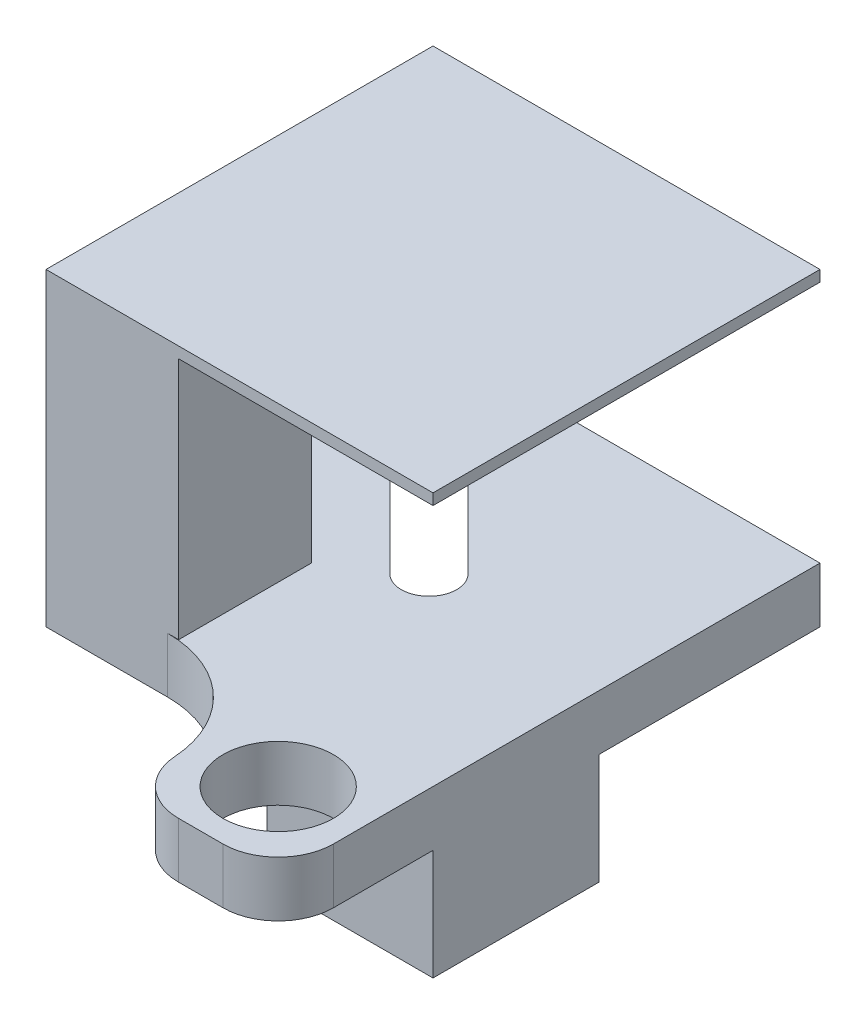
from build123d import *

# Parameters (mm, degrees)
SKETCH1_R           = 5
BOSS_EXTRUDE1_DEPTH = 5
BOSS_EXTRUDE2_DEPTH = 10
SKETCH3_W           = 12
SKETCH3_H           = 12
BOSS_EXTRUDE3_DEPTH = 22
SKETCH4_W           = 35
SKETCH4_H           = 35
BOSS_EXTRUDE4_DEPTH = 1
FILLET1_R           = 10
FILLET4_R           = 5


with BuildPart() as part:
    # Sketch1 → Boss-Extrude1 (new body)
    with BuildSketch(Plane(origin=(0, 0, 0), x_dir=(1, 0, 0), z_dir=(0, 1, 0))):
        Polygon((0, 0), (0, 35), (35, 35), (35, 0), (35, -14), (21, -14), (21, 0), align=None)
        with Locations(Location((28, -7, 0), (0, 0, 270))):
            Circle(SKETCH1_R, mode=Mode.SUBTRACT)
        with BuildLine():
            Line((5.77728435, 32.399644503), (19.919419974, 18.257508879))
            ThreePointArc((19.919419974, 18.257508879), (19.829534471, 14.632089471), (16.21302376, 14.901525103))
            Line((16.21302376, 14.901525103), (2.070888136, 29.043660727))
            ThreePointArc((2.070888136, 29.043660727), (2.160773638, 32.669080135), (5.77728435, 32.399644503))
        make_face(mode=Mode.SUBTRACT)
    extrude(amount=BOSS_EXTRUDE1_DEPTH)

    # Sketch2 → Boss-Extrude2 (add)
    with BuildSketch(Plane.XZ):
        Polygon((30, -5), (20, -5), (20, 0), (35, 0), (35, -15), (30, -15), align=None)
    extrude(amount=BOSS_EXTRUDE2_DEPTH)

    # Sketch3 → Boss-Extrude3 (add)
    with BuildSketch(Plane(origin=(0, 5, 0), x_dir=(1, 0, 0), z_dir=(0, 1, 0))):
        with Locations((6, 6)):
            Rectangle(SKETCH3_W, SKETCH3_H)
    extrude(amount=BOSS_EXTRUDE3_DEPTH)

    # Sketch4 → Boss-Extrude4 (add)
    with BuildSketch(Plane(origin=(0, 27, 0), x_dir=(1, 0, 0), z_dir=(0, 1, 0))):
        with Locations((17.5, 17.5)):
            Rectangle(SKETCH4_W, SKETCH4_H)
    extrude(amount=BOSS_EXTRUDE4_DEPTH)

    # Fillet1
    # the kernel refuses this fillet: 10 mm, written as the material it adds along each edge
    with BuildSketch(Plane(origin=(21, 0, 0), x_dir=(0, 0, 1), z_dir=(0, 1, 0))) as fillet1_piece_1:
        with BuildLine():
            CenterArc((FILLET1_R, -FILLET1_R), FILLET1_R, 90, 90)
            Line((0, -FILLET1_R), (0, 0))
            Line((0, 0), (FILLET1_R, 0))
        make_face()
    extrude(amount=5)

    # Fillet4
    fillet4_edges = [part.edges().sort_by_distance(p)[0] for p in [
        (35, 2.5, 14),
        (21, 2.5, 14),
    ]]
    fillet(fillet4_edges, radius=FILLET4_R)


solid = part.part
